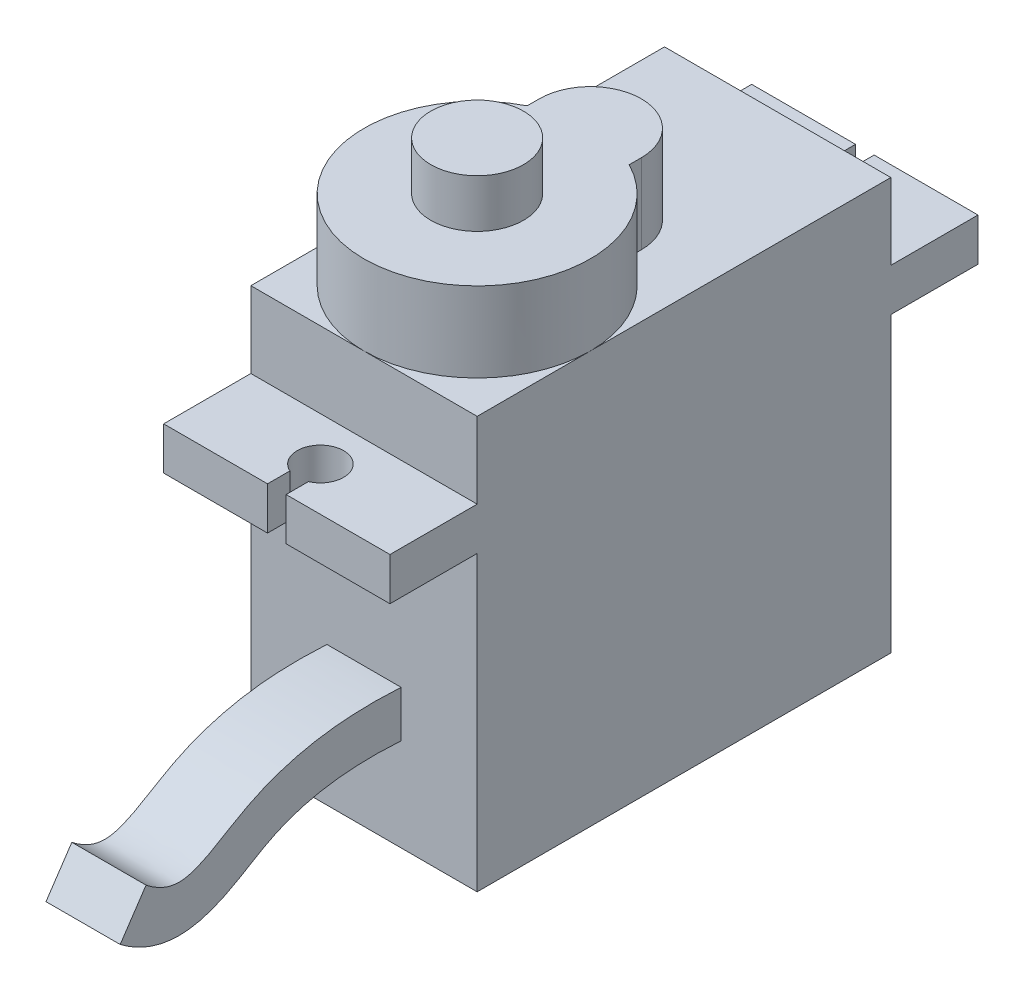
from build123d import *

# Parameters (mm, degrees)
EXTRUDE_1_DEPTH     = 6.1
EXTRUDE_2_DEPTH     = 4.3
SKETCH_3_R          = 2.5
EXTRUDE_3_DEPTH     = 2.6
SWEEP_START         = -2
SWEEP_1_DEPTH       = 4
CUT_EXTRUDE_1_DEPTH = 3


# Read off the part's stored shape, not the designer's step: По траектории1
with BuildPart() as part:
    # Эскиз1 → Бобышка-Вытянуть1 (new, symmetric)
    with BuildSketch(Plane(origin=(0, 0, 0), x_dir=(0, 0, -1), z_dir=(1, 0, 0))):
        Polygon((0, 0), (22.3, 0), (22.3, 15.8), (27, 15.8), (27, 18.1), (22.3, 18.1), (22.3, 22.2), (0, 22.2), (0, 18.1), (-4.7, 18.1), (-4.7, 15.8), (0, 15.8), align=None)
    extrude(amount=EXTRUDE_1_DEPTH, both=True)

    # Эскиз2 → Бобышка-Вытянуть2 (add)
    with BuildSketch(Plane(origin=(0, 22.2, 0), x_dir=(1, 0, 0), z_dir=(0, 1, 0))):
        with BuildLine():
            Line((-2.75, 12.2), (-2.75, 11.54495179))
            ThreePointArc((-2.75, 11.54495179), (0, 0), (2.75, 11.54495179))
            Line((2.75, 11.54495179), (2.75, 12.2))
            ThreePointArc((2.75, 12.2), (0, 14.95), (-2.75, 12.2))
        make_face()
    extrude(amount=EXTRUDE_2_DEPTH)

    # Эскиз3 → Бобышка-Вытянуть3 (add)
    with BuildSketch(Plane(origin=(0, 26.5, 0), x_dir=(1, 0, 0), z_dir=(0, 1, 0))):
        with Locations(Location((0, 6.1, 0), (0, 0, 270))):
            Circle(SKETCH_3_R)
    extrude(amount=EXTRUDE_3_DEPTH)

    # По траектории1 outline → По траектории1 (add)
    with BuildSketch(Plane.YZ.offset(SWEEP_START)):
        with BuildLine():
            Line((5, 0), (7.5, 0))
            add(Edge.make_bspline(
                [(7.5, 0), (7.55466995, 0.932768751), (7.567397074, 2.054373731), (7.427446861, 3.871339503), (7.144525851, 5.668082774), (6.567191568, 7.327579523), (5.845700953, 8.750774075), (5.129629815, 9.89551827), (4.584016429, 10.917508592), (4.409004277, 11.592638933), (4.374327462, 11.966191087), (4.40728466, 12.331644555), (4.518227027, 12.728854054), (4.738611449, 13.18957707), (4.985731728, 13.5588281), (5.139543938, 13.750446366)],
                knots=[0, 0, 0, 0, 0.166666667, 0.203301869, 0.333333333, 0.5, 0.519938297, 0.625, 0.75, 0.791666667, 0.833333333, 0.875, 0.916666667, 0.958333333, 1, 1, 1, 1], degree=3))
            Line((5.139543938, 13.750446366), (3.063253187, 15.142932171))
            add(Edge.make_bspline(
                [(5, 0), (5.057281604, 0.840170125), (5.073194453, 1.848822262), (4.963561919, 3.425294528), (4.739313637, 4.934487741), (4.312374062, 6.230912608), (3.740083573, 7.399180935), (3.13051994, 8.398930623), (2.368002426, 9.70405156), (1.994241871, 10.907667376), (1.874475502, 11.699413606), (1.900467078, 12.546155788), (2.099949953, 13.416272622), (2.478763958, 14.286542274), (2.848255397, 14.852807038), (3.063253187, 15.142932171)],
                knots=[0, 0, 0, 0, 0.166666667, 0.203301869, 0.333333333, 0.5, 0.519938297, 0.625, 0.75, 0.791666667, 0.833333333, 0.875, 0.916666667, 0.958333333, 1, 1, 1, 1], degree=3))
        make_face()
    extrude(amount=SWEEP_1_DEPTH)

    # Эскиз6 → Вырез-Вытянуть1 (cut)
    with BuildSketch(Plane(origin=(0, 18.1, 0), x_dir=(1, 0, 0), z_dir=(0, 1, 0))):
        with BuildLine():
            Line((-0.5, 27), (-0.5, 25.795643924))
            ThreePointArc((-0.5, 25.795643924), (0, 23.4), (0.5, 25.795643924))
            Line((0.5, 25.795643924), (0.5, 27))
            Line((0.5, 27), (0, 27))
            Line((0, 27), (-0.5, 27))
        make_face()
        with BuildLine():
            Line((0.5, -4.7), (0.5, -3.495643924))
            ThreePointArc((0.5, -3.495643924), (0, -1.1), (-0.5, -3.495643924))
            Line((-0.5, -3.495643924), (-0.5, -4.7))
            Line((-0.5, -4.7), (0, -4.7))
            Line((0, -4.7), (0.5, -4.7))
        make_face()
    extrude(amount=-CUT_EXTRUDE_1_DEPTH, mode=Mode.SUBTRACT)


solid = part.part
